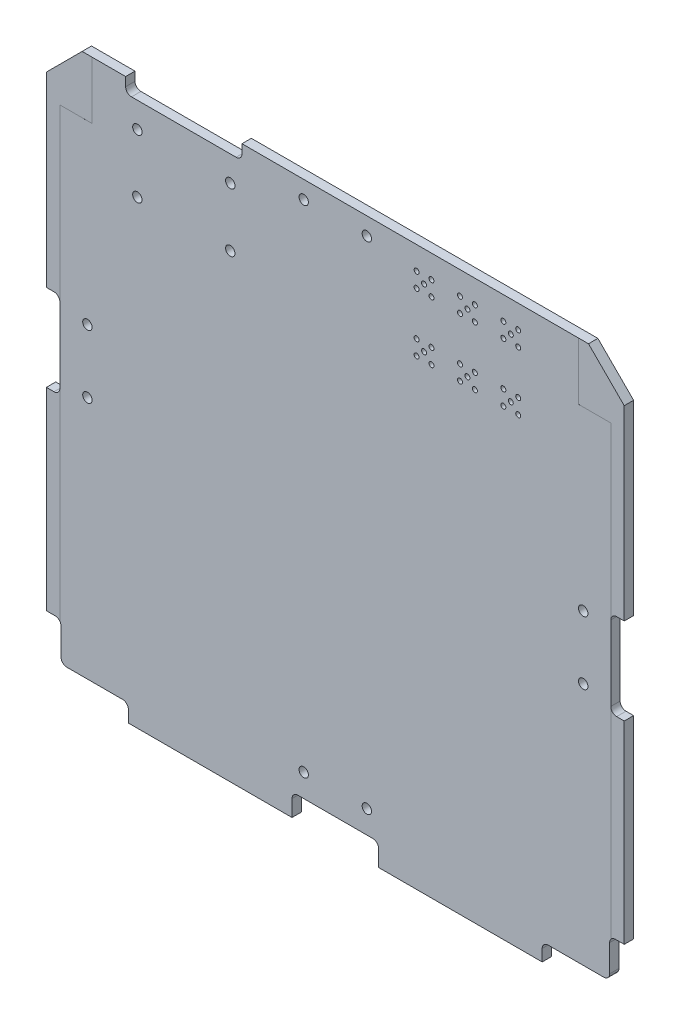
from build123d import *

# Parameters (mm, degrees)
SKETCH1_R                = 0.425
BOSS_EXTRUDE1_DEPTH      = 1.6
LPATTERN2_START          = -0.0125
LPATTERN2_OUTLINE_R      = 0.425
LPATTERN2_DEPTH          = 1.6
SLOTFOOTPRINTS_REF_DEPTH = 0.0001
SLOTFOOTPRINTS_DEPTH     = 0.0001
SKETCH2_R                = 0.8
F_20PIN_MOUNTS_DEPTH     = 71.235674696
SKETCH3_R                = 0.8
F_12PIN_MOUNTS_DEPTH     = 10


# Read off the part's stored shape, not the designer's step: LPattern2
with BuildPart() as part:
    # Sketch1 → Boss-Extrude1 (new body)
    with BuildSketch(Plane(origin=(0, 0, -0.0125), x_dir=(-1, 0, 0), z_dir=(0, 0, -1))):
        with BuildLine():
            Line((35.3, -50), (35.3, -48))
            ThreePointArc((35.3, -48), (35.592893219, -47.292893219), (36.3, -47))
            Line((36.3, -47), (45.8, -47))
            ThreePointArc((45.8, -47), (46.507106781, -46.707106781), (46.8, -46))
            Line((46.8, -46), (46.8, -41.4))
            ThreePointArc((46.8, -41.4), (47.092893219, -40.692893219), (47.8, -40.4))
            Line((47.8, -40.4), (49.3, -40.4))
            Line((49.3, -40.4), (49.3, 39.2))
            Line((49.3, 39.2), (43.2, 45.3))
            Line((43.2, 45.3), (35.500000002, 45.3))
            Line((35.500000002, 45.3), (3.499999998, 45.3))
            Line((3.499999998, 45.3), (-43.2, 45.3))
            Line((-43.2, 45.3), (-49.3, 39.2))
            Line((-49.3, 39.2), (-49.3, -40.4))
            Line((-49.3, -40.4), (-47.8, -40.4))
            ThreePointArc((-47.8, -40.4), (-47.092893219, -40.692893219), (-46.8, -41.4))
            Line((-46.8, -41.4), (-46.8, -46))
            ThreePointArc((-46.8, -46), (-46.507106781, -46.707106781), (-45.8, -47))
            Line((-45.8, -47), (-36.3, -47))
            ThreePointArc((-36.3, -47), (-35.592893219, -47.292893219), (-35.3, -48))
            Line((-35.3, -48), (-35.3, -50))
            Line((-35.3, -50), (35.3, -50))
        make_face()
        with Locations(Location((-21.27, 41.37, 0), (0, 0, 180))):
            Circle(SKETCH1_R, mode=Mode.SUBTRACT)
        with Locations(Location((-23.81, 41.37, 0), (0, 0, 180))):
            Circle(SKETCH1_R, mode=Mode.SUBTRACT)
        with Locations(Location((-22.54, 40.1, 0), (0, 0, 180))):
            Circle(SKETCH1_R, mode=Mode.SUBTRACT)
        with Locations(Location((-13.87, 41.37, 0), (0, 0, 180))):
            Circle(SKETCH1_R, mode=Mode.SUBTRACT)
        with Locations(Location((-23.81, 38.83, 0), (0, 0, 180))):
            Circle(SKETCH1_R, mode=Mode.SUBTRACT)
        with Locations(Location((-16.41, 41.37, 0), (0, 0, 180))):
            Circle(SKETCH1_R, mode=Mode.SUBTRACT)
        with Locations(Location((-15.14, 40.1, 0), (0, 0, 180))):
            Circle(SKETCH1_R, mode=Mode.SUBTRACT)
        with Locations(Location((-21.27, 38.83, 0), (0, 0, 180))):
            Circle(SKETCH1_R, mode=Mode.SUBTRACT)
        with Locations(Location((-28.67, 41.37, 0), (0, 0, 180))):
            Circle(SKETCH1_R, mode=Mode.SUBTRACT)
        with Locations(Location((-31.21, 41.37, 0), (0, 0, 180))):
            Circle(SKETCH1_R, mode=Mode.SUBTRACT)
        with Locations(Location((-16.41, 38.83, 0), (0, 0, 180))):
            Circle(SKETCH1_R, mode=Mode.SUBTRACT)
        with Locations(Location((-29.94, 40.1, 0), (0, 0, 180))):
            Circle(SKETCH1_R, mode=Mode.SUBTRACT)
        with Locations(Location((-31.21, 38.83, 0), (0, 0, 180))):
            Circle(SKETCH1_R, mode=Mode.SUBTRACT)
        with Locations(Location((-28.67, 38.83, 0), (0, 0, 180))):
            Circle(SKETCH1_R, mode=Mode.SUBTRACT)
        with Locations(Location((-13.87, 38.83, 0), (0, 0, 180))):
            Circle(SKETCH1_R, mode=Mode.SUBTRACT)
    extrude(amount=-BOSS_EXTRUDE1_DEPTH)

    # LPattern2 outline → LPattern2 (cut)
    with BuildSketch(Plane.XY.offset(LPATTERN2_START)):
        with Locations((31.21, 31.37)):
            Circle(LPATTERN2_OUTLINE_R)
        with Locations((31.21, 28.83)):
            Circle(LPATTERN2_OUTLINE_R)
        with Locations((29.94, 30.1)):
            Circle(LPATTERN2_OUTLINE_R)
        with Locations((28.67, 28.83)):
            Circle(LPATTERN2_OUTLINE_R)
        with Locations((28.67, 31.37)):
            Circle(LPATTERN2_OUTLINE_R)
        with Locations((16.41, 31.37)):
            Circle(LPATTERN2_OUTLINE_R)
        with Locations((23.81, 31.37)):
            Circle(LPATTERN2_OUTLINE_R)
        with Locations((23.81, 28.83)):
            Circle(LPATTERN2_OUTLINE_R)
        with Locations((22.54, 30.1)):
            Circle(LPATTERN2_OUTLINE_R)
        with Locations((21.27, 28.83)):
            Circle(LPATTERN2_OUTLINE_R)
        with Locations((21.27, 31.37)):
            Circle(LPATTERN2_OUTLINE_R)
        with Locations((16.41, 28.83)):
            Circle(LPATTERN2_OUTLINE_R)
        with Locations((15.14, 30.1)):
            Circle(LPATTERN2_OUTLINE_R)
        with Locations((13.87, 28.83)):
            Circle(LPATTERN2_OUTLINE_R)
        with Locations((13.87, 31.37)):
            Circle(LPATTERN2_OUTLINE_R)
    extrude(amount=LPATTERN2_DEPTH, mode=Mode.SUBTRACT)

    # thermalContacts_lower → slotFootprints_REF (cut)
    with BuildSketch(Plane(origin=(0, 0, -0.0125), x_dir=(-1, 0, 0), z_dir=(0, 0, -1))):
        Polygon((47, 35.5), (47, -41.5), (59.827263463, -41.5), (59.827263463, 47), (41.5, 47), (41.5, 41.5), (41.5, 35.5), align=None)
        Polygon((-47, 35.5), (-47, -41.5), (-56.192158269, -41.5), (-56.192158269, 47), (-41.5, 47), (-41.5, 41.5), (-41.5, 35.5), align=None)
    extrude(amount=-SLOTFOOTPRINTS_REF_DEPTH, mode=Mode.SUBTRACT)

    # thermalContacts_upper → slotFootprints (cut)
    with BuildSketch(Plane.XY.offset(1.5875)):
        Polygon((-47, 35.5), (-47, -41.5), (-56.192158269, -41.5), (-56.192158269, 47), (-41.5, 47), (-41.5, 41.5), (-41.5, 35.5), align=None)
        Polygon((47, 35.5), (47, -41.5), (59.827263463, -41.5), (59.827263463, 47), (41.5, 47), (41.5, 41.5), (41.5, 35.5), align=None)
    extrude(amount=-SLOTFOOTPRINTS_DEPTH, mode=Mode.SUBTRACT)

    # Sketch2 → 20pin_mounts (cut, through all)
    with BuildSketch(Plane.XY.offset(1.5875)):
        with Locations((-33.775, 38.472296419)):
            Circle(SKETCH2_R)
        with Locations((-17.925, 38.472296419)):
            Circle(SKETCH2_R)
        with Locations((-17.925, 28.472296419)):
            Circle(SKETCH2_R)
        with Locations((-33.775, 28.472296419)):
            Circle(SKETCH2_R)
        with BuildLine():
            Line((-35.775, 45.3), (-35.775, 43.8))
            ThreePointArc((-35.775, 43.8), (-35.482106781, 43.092893219), (-34.775, 42.8))
            Line((-34.775, 42.8), (-16.925, 42.8))
            ThreePointArc((-16.925, 42.8), (-16.217893218, 43.092893219), (-15.925, 43.8))
            Line((-15.925, 43.8), (-15.925, 45.3))
            Line((-15.925, 45.3), (-35.775, 45.3))
        make_face()
    extrude(amount=-F_20PIN_MOUNTS_DEPTH, mode=Mode.SUBTRACT)

    # Sketch3 → 12pin_mounts (cut)
    with BuildSketch(Plane(origin=(0, 0, -0.0125), x_dir=(-1, 0, 0), z_dir=(0, 0, -1))):
        with Locations((5.390000006, 42.3)):
            Circle(SKETCH3_R)
        with Locations((-5.379999994, 42.3)):
            Circle(SKETCH3_R)
        with Locations((42.3, 5.379999994)):
            Circle(SKETCH3_R)
        with Locations((42.3, -5.390000006)):
            Circle(SKETCH3_R)
        with Locations((5.390000006, -42.303202712)):
            Circle(SKETCH3_R)
        with Locations((-5.379999994, -42.303202712)):
            Circle(SKETCH3_R)
        with Locations((-42.3, -5.390000006)):
            Circle(SKETCH3_R)
        with Locations((-42.3, 5.379999994)):
            Circle(SKETCH3_R)
        with BuildLine():
            Line((-49.3, 7.379999994), (-48, 7.379999994))
            ThreePointArc((-48, 7.379999994), (-47.292893219, 7.087106775), (-47, 6.379999994))
            Line((-47, 6.379999994), (-47, -6.390000006))
            ThreePointArc((-47, -6.390000006), (-47.292893219, -7.097106787), (-48, -7.390000006))
            Line((-48, -7.390000006), (-49.3, -7.390000006))
            Line((-49.3, -7.390000006), (-49.3, 7.379999994))
        make_face()
        with BuildLine():
            Line((48, 7.379999994), (49.3, 7.379999994))
            Line((49.3, 7.379999994), (49.3, -7.390000006))
            Line((49.3, -7.390000006), (48, -7.390000006))
            ThreePointArc((48, -7.390000006), (47.292893219, -7.097106787), (47, -6.390000006))
            Line((47, -6.390000006), (47, 6.379999994))
            ThreePointArc((47, 6.379999994), (47.292893219, 7.087106775), (48, 7.379999994))
        make_face()
        with BuildLine():
            Line((-6.379999994, -46.203202712), (6.390000006, -46.203202712))
            ThreePointArc((6.390000006, -46.203202712), (7.097106787, -46.496095931), (7.390000006, -47.203202712))
            Line((7.390000006, -47.203202712), (7.390000006, -50))
            Line((7.390000006, -50), (-7.379999994, -50))
            Line((-7.379999994, -50), (-7.379999994, -47.203202712))
            ThreePointArc((-7.379999994, -47.203202712), (-7.087106775, -46.496095931), (-6.379999994, -46.203202712))
        make_face()
    extrude(amount=-F_12PIN_MOUNTS_DEPTH, mode=Mode.SUBTRACT)


solid = part.part
